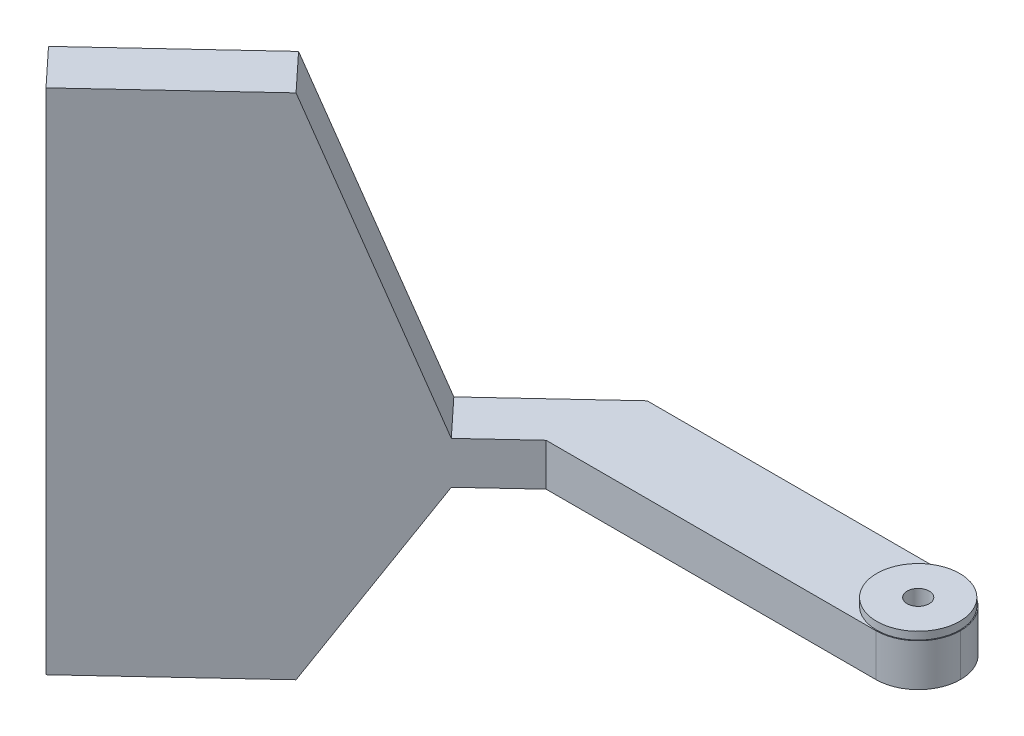
from build123d import *

# Parameters (mm, degrees)
BOSS_EXTRUDE1_DEPTH = 5
FILLET1_R           = 5
SKETCH2_R           = 1.3
CUT_EXTRUDE1_DEPTH  = 10
BOSS_EXTRUDE2_DEPTH = 35
BOSS_EXTRUDE3_DEPTH = 20
BOSS_EXTRUDE4_DEPTH = 6
BOSS_EXTRUDE5_START = 0.9
SKETCH6_R           = 4.9
SKETCH6_R_2         = 1.3
BOSS_EXTRUDE5_DEPTH = 0.9


with BuildPart() as part:
    # Sketch1 → Boss-Extrude1 (new body)
    with BuildSketch(Plane(origin=(0, 0, 0), x_dir=(1, 0, 0), z_dir=(0, 1, 0))):
        Polygon((4.09199016, 5.61187779), (0, 10), (0, 1.796035233), align=None)
        Polygon((0, 1.796035233), (0, 10), (-36.567685081, -24.099918003), (-32.475694921, -28.488040213), (-1.926011986, 0), align=None)
        Polygon((42, 10), (0, 10), (4.09199016, 5.61187779), (0, 1.796035233), (0, 0), (42, 0), align=None)
        Polygon((0, 0), (0, 1.796035233), (-1.926011986, 0), align=None)
    extrude(amount=BOSS_EXTRUDE1_DEPTH)

    # Fillet1
    fillet1_edges = [part.edges().sort_by_distance(p)[0] for p in [
        (42, 2.5, 0),
        (42, 2.5, -10),
    ]]
    fillet(fillet1_edges, radius=FILLET1_R - 0.0001)  # a hair under: the kernel refuses the full size

    # Sketch2 → Cut-Extrude1 (cut)
    with BuildSketch(Plane(origin=(0, 5, 0), x_dir=(1, 0, 0), z_dir=(0, 1, 0))):
        with Locations(Location((37, 5, 0), (0, 0, 270))):
            Circle(SKETCH2_R)
    extrude(amount=-CUT_EXTRUDE1_DEPTH, mode=Mode.SUBTRACT)

    # Sketch3 → Boss-Extrude2 (add)
    with BuildSketch(Plane(origin=(0, 5, 0), x_dir=(1, 0, 0), z_dir=(0, 1, 0))):
        Polygon((-36.567685081, -24.099918003), (-32.475694921, -28.488040213), (-17.200853453, -14.244020106), (-21.292843614, -9.855897897), align=None)
    extrude(amount=BOSS_EXTRUDE2_DEPTH)

    # Sketch4 → Boss-Extrude3 (add)
    with BuildSketch(Plane.XZ):
        Polygon((-36.567685081, 24.099918003), (-32.475694921, 28.488040213), (-17.200853453, 14.244020106), (-21.292843614, 9.855897897), align=None)
    extrude(amount=BOSS_EXTRUDE3_DEPTH)

    # Sketch5 → Boss-Extrude4 (add)
    with BuildSketch(Plane(origin=(-4.987820251, 0, -5.348782369), x_dir=(-0.7313537016191739, 0, 0.6819983600624947), z_dir=(-0.6819983600624948, 0, -0.731353701619174))):
        Polygon((22.294306197, -20), (22.294306197, 0), (9.326364945, 0), align=None)
        Polygon((9.326364945, 5), (22.294306197, 40), (22.294306197, 5), align=None)
    extrude(amount=-BOSS_EXTRUDE4_DEPTH)

    # Sketch6 → Boss-Extrude5 (add)
    with BuildSketch(Plane(origin=(0, 5, 0), x_dir=(1, 0, 0), z_dir=(0, 1, 0)).offset(BOSS_EXTRUDE5_START)):
        with Locations(Location((37, 5, 0), (0, 0, 270))):
            Circle(SKETCH6_R)
        with Locations(Location((37, 5, 0), (0, 0, 270))):
            Circle(SKETCH6_R_2, mode=Mode.SUBTRACT)
    extrude(amount=-BOSS_EXTRUDE5_DEPTH)


solid = part.part
